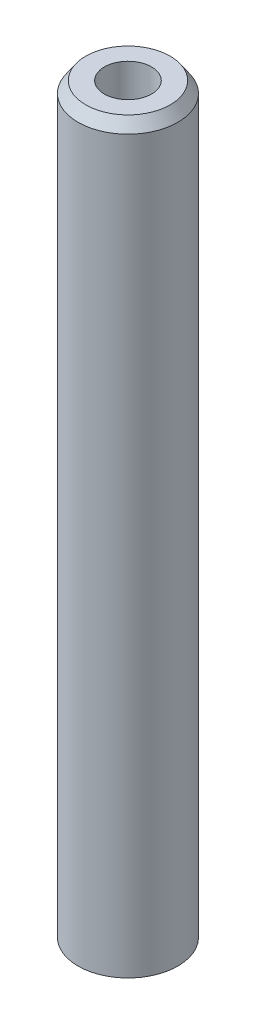
from build123d import *
from OCP.BRepFilletAPI import BRepFilletAPI_MakeChamfer

# Parameters (mm, degrees)
SKETCH1_R           = 10
BOSS_EXTRUDE1_DEPTH = 150.184684521
SKETCH2_R           = 4.721582319
CUT_EXTRUDE1_DEPTH  = 151.849061862
CHAMFER1_SIZE       = 2.254561685
CHAMFER1_SIZE2      = 1.541383136


with BuildPart() as part:
    # Sketch1 → Boss-Extrude1 (new body)
    with BuildSketch(Plane(origin=(0, 0, 0), x_dir=(1, 0, 0), z_dir=(0, 1, 0))):
        Circle(SKETCH1_R)
    extrude(amount=BOSS_EXTRUDE1_DEPTH)

    # Sketch2 → Cut-Extrude1 (cut, through all)
    with BuildSketch(Plane(origin=(0, 0, 0), x_dir=(1, 0, 0), z_dir=(0, 1, 0))):
        Circle(SKETCH2_R)
    extrude(amount=CUT_EXTRUDE1_DEPTH, mode=Mode.SUBTRACT)

    # Chamfer1: one chamfer whose edges measure the first distance from different faces: ONE call of the kernel's chamfer builder (chamfer() names one face for all edges)
    chamfer1_edges_1 = [part.edges().sort_by_distance(p)[0] for p in [
        (-10, 150.184684521, 0),
    ]]
    chamfer1_side_1 = [part.faces().sort_by_distance(p)[0] for p in [
        (-10, 75.09234226, 0),
    ]]
    chamfer1_edges_2 = [part.edges().sort_by_distance(p)[0] for p in [
        (-10, 0, 0),
    ]]
    chamfer1_side_2 = [part.faces().sort_by_distance(p)[0] for p in [
        (-9.717157288, 0, 0),
    ]]
    chamfer1 = BRepFilletAPI_MakeChamfer(part.part.solid().wrapped)
    for e in chamfer1_edges_1:
        chamfer1.Add(CHAMFER1_SIZE, CHAMFER1_SIZE2, e.wrapped, chamfer1_side_1[0].wrapped)  # the first distance lies on this face
    for e in chamfer1_edges_2:
        chamfer1.Add(CHAMFER1_SIZE, CHAMFER1_SIZE2, e.wrapped, chamfer1_side_2[0].wrapped)  # the first distance lies on this face
    add(Compound.cast(chamfer1.Shape()), mode=Mode.REPLACE)


solid = part.part
